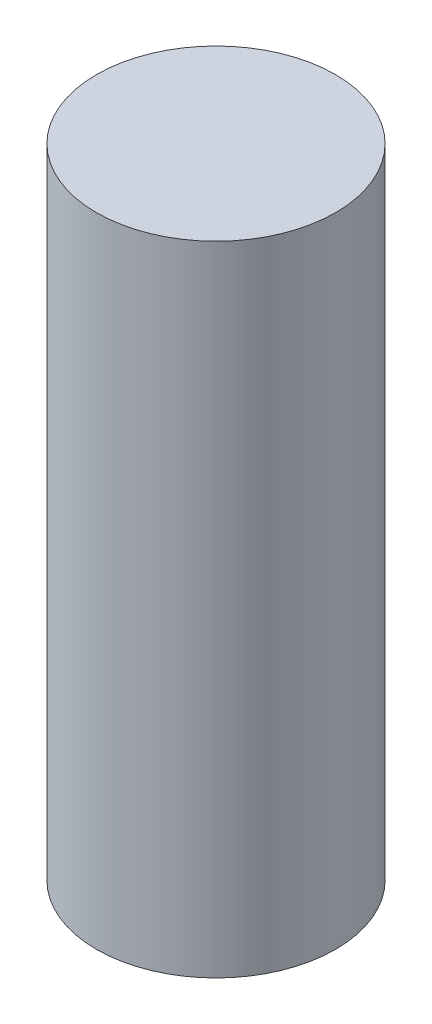
from build123d import *

# Parameters (mm, degrees)
SKETCH1_R           = 2.38
BOSS_EXTRUDE1_DEPTH = 12.7


with BuildPart() as part:
    # Sketch1 → Boss-Extrude1 (new body)
    with BuildSketch(Plane(origin=(0, 0, 0), x_dir=(1, 0, 0), z_dir=(0, 1, 0))):
        Circle(SKETCH1_R)
    extrude(amount=BOSS_EXTRUDE1_DEPTH)


solid = part.part
